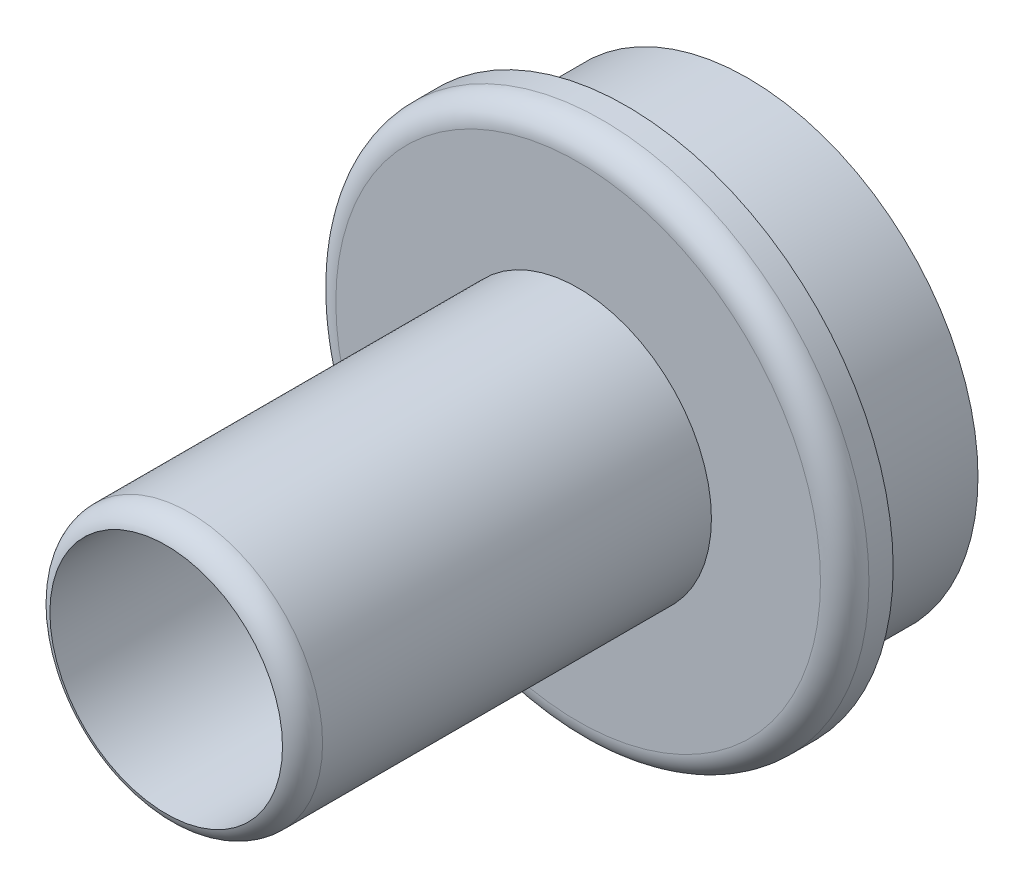
from build123d import *

# Parameters (mm, degrees)
SKETCH1_R           = 11
BOSS_EXTRUDE1_DEPTH = 2
SKETCH2_R           = 9.5
BOSS_EXTRUDE2_DEPTH = 5
SKETCH3_R           = 5.5
BOSS_EXTRUDE3_DEPTH = 17
SKETCH4_R           = 4.8
CUT_EXTRUDE1_DEPTH  = 25
SKETCH5_R           = 8.8
CUT_EXTRUDE2_DEPTH  = 5.5
FILLET1_R           = 2
FILLET2_R           = 1
FILLET3_R           = 1


with BuildPart() as part:
    # Sketch1 → Boss-Extrude1 (new body)
    with BuildSketch(Plane.XY):
        Circle(SKETCH1_R)
    extrude(amount=BOSS_EXTRUDE1_DEPTH)

    # Sketch2 → Boss-Extrude2 (add)
    with BuildSketch(Plane(origin=(0, 0, 0), x_dir=(-1, 0, 0), z_dir=(0, 0, -1))):
        Circle(SKETCH2_R)
    extrude(amount=BOSS_EXTRUDE2_DEPTH)

    # Sketch3 → Boss-Extrude3 (add)
    with BuildSketch(Plane.XY.offset(2)):
        Circle(SKETCH3_R)
    extrude(amount=BOSS_EXTRUDE3_DEPTH)

    # Sketch4 → Cut-Extrude1 (cut)
    with BuildSketch(Plane.XY.offset(19)):
        Circle(SKETCH4_R)
    extrude(amount=-CUT_EXTRUDE1_DEPTH, mode=Mode.SUBTRACT)

    # Sketch5 → Cut-Extrude2 (cut)
    with BuildSketch(Plane(origin=(0, 0, -5), x_dir=(-1, 0, 0), z_dir=(0, 0, -1))):
        Circle(SKETCH5_R)
    extrude(amount=-CUT_EXTRUDE2_DEPTH, mode=Mode.SUBTRACT)

    # Fillet1
    fillet1_edges = [part.edges().sort_by_distance(p)[0] for p in [
        (-4.8, 0, 0.5),
    ]]
    fillet(fillet1_edges, radius=FILLET1_R)

    # Fillet2
    fillet2_edges = [part.edges().sort_by_distance(p)[0] for p in [
        (-11, 0, 2),
    ]]
    fillet(fillet2_edges, radius=FILLET2_R)

    # Fillet3
    # the kernel refuses this fillet: 1 mm, written as the material it takes off along each edge
    with BuildSketch(Plane(origin=(0, 0, 19), x_dir=(1, 0, 0), z_dir=(0, -1, 0))) as fillet3_piece_1:
        with BuildLine():
            CenterArc((4.5, -0.953939201), FILLET3_R, 0, 72.542396876)
            Line((4.8, 0), (4.806, 0.019078784))
            ThreePointArc((4.806, 0.019078784), (5.15, 0.02), (5.5, 0.02))
            Line((5.5, 0.02), (5.52, 0))
            Line((5.52, 0), (5.52, -0.953939201))
            Line((5.52, -0.953939201), (5.5, -0.953939201))
        make_face()
    revolve(axis=Axis((0, 0, 19), (0, 0, 1)), mode=Mode.SUBTRACT)


solid = part.part
